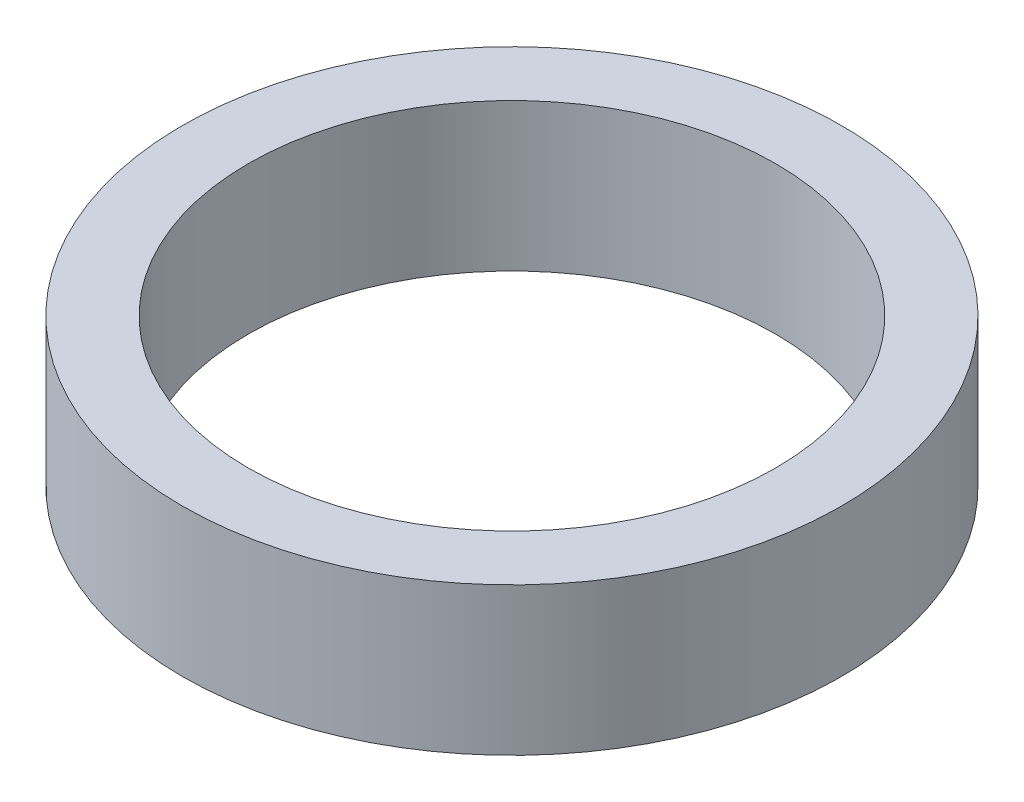
from build123d import *

# Parameters (mm, degrees)
SKETCH1_R           = 62.5
BOSS_EXTRUDE1_DEPTH = 28
SKETCH2_R           = 50
CUT_EXTRUDE1_DEPTH  = 93.717312299


with BuildPart() as part:
    # Sketch1 → Boss-Extrude1 (new body)
    with BuildSketch(Plane(origin=(0, 0, 0), x_dir=(1, 0, 0), z_dir=(0, 1, 0))):
        Circle(SKETCH1_R)
    extrude(amount=BOSS_EXTRUDE1_DEPTH)

    # Sketch2 → Cut-Extrude1 (cut, through all)
    with BuildSketch(Plane(origin=(0, 0, 0), x_dir=(1, 0, 0), z_dir=(0, 1, 0))):
        Circle(SKETCH2_R)
    extrude(amount=CUT_EXTRUDE1_DEPTH, mode=Mode.SUBTRACT)


solid = part.part
